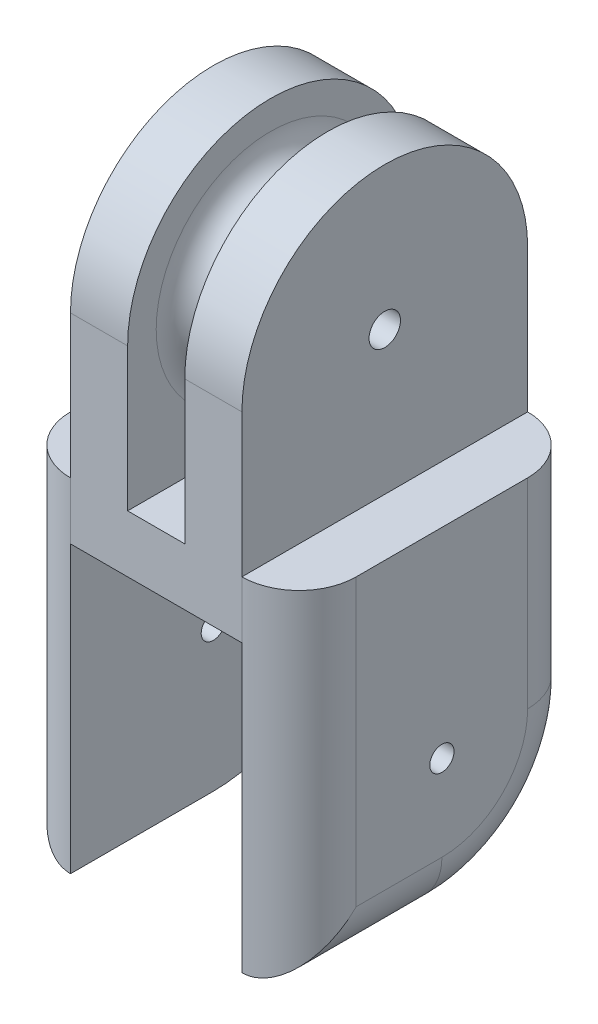
from build123d import *

# Parameters (mm, degrees)
SKETCH1_W           = 20
SKETCH1_H           = 20
BOSS_EXTRUDE1_DEPTH = 4
SKETCH4_W           = 4
SKETCH4_H           = 20
BOSS_EXTRUDE2_DEPTH = 10
BOSS_EXTRUDE3_DEPTH = 4
BOSS_EXTRUDE4_START = -4
BOSS_EXTRUDE4_DEPTH = 4
SKETCH7_R           = 0.85
CUT_EXTRUDE1_DEPTH  = 31
FILLET1_R           = 4
SKETCH8_W           = 4
SKETCH8_H           = 20
BOSS_EXTRUDE5_DEPTH = 10
SKETCH9_R           = 10
BOSS_EXTRUDE6_DEPTH = 4
BOSS_EXTRUDE7_START = -4
SKETCH10_R          = 10
BOSS_EXTRUDE7_DEPTH = 4
SKETCH12_R          = 1.1
CUT_EXTRUDE2_DEPTH  = 31.528675045
SKETCH13_R          = 6
BOSS_EXTRUDE8_DEPTH = 4
SKETCH14_R          = 1.1
CUT_EXTRUDE3_DEPTH  = 4
FILLET2_R           = 2
CUT_EXTRUDE4_REACH  = 29.857
SKETCH16_R          = 0.5


with BuildPart() as part:
    # Sketch1 → Boss-Extrude1 (new body)
    with BuildSketch(Plane(origin=(0, 0, 0), x_dir=(1, 0, 0), z_dir=(0, 1, 0))):
        Rectangle(SKETCH1_W, SKETCH1_H)
    extrude(amount=BOSS_EXTRUDE1_DEPTH)

    # Sketch4 → Boss-Extrude2 (add)
    with BuildSketch(Plane.XZ):
        with Locations((-8, 0)):
            Rectangle(SKETCH4_W, SKETCH4_H)
        with Locations((8, 0)):
            Rectangle(SKETCH4_W, SKETCH4_H)
    extrude(amount=BOSS_EXTRUDE2_DEPTH)

    # Sketch5 → Boss-Extrude3 (add)
    with BuildSketch(Plane.ZY.offset(10)):
        with BuildLine():
            Line((0, -20), (10, -20))
            Line((10, -20), (10, -10))
            ThreePointArc((10, -10), (-7.071067812, -2.928932188), (0, -20))
        make_face()
    extrude(amount=-BOSS_EXTRUDE3_DEPTH)

    # Sketch6 → Boss-Extrude4 (add)
    with BuildSketch(Plane(origin=(10, 0, 0), x_dir=(0, 0, -1), z_dir=(1, 0, 0)).offset(BOSS_EXTRUDE4_START)):
        with BuildLine():
            Line((0, -20), (-10, -20))
            Line((-10, -20), (-10, -10))
            ThreePointArc((-10, -10), (7.071067812, -2.928932188), (0, -20))
        make_face()
    extrude(amount=BOSS_EXTRUDE4_DEPTH)

    # Sketch7 → Cut-Extrude1 (cut, through all)
    with BuildSketch(Plane.ZY.offset(10)):
        with Locations((0, -10)):
            Circle(SKETCH7_R)
    extrude(amount=-CUT_EXTRUDE1_DEPTH, mode=Mode.SUBTRACT)

    # Fillet1
    fillet1_edges = [part.edges().sort_by_distance(p)[0] for p in [
        (-10, -8, 10),
        (-10, -17.071067812, -7.071067812),
        (10, -8, 10),
        (10, -17.071067812, -7.071067812),
        (-10, -3, -10),
        (10, -3, -10),
        (10, -20, 5),
        (-10, -20, 5),
    ]]
    fillet(fillet1_edges, radius=FILLET1_R - 0.0001)  # a hair under: the kernel refuses the full size

    # Sketch8 → Boss-Extrude5 (add)
    with BuildSketch(Plane(origin=(0, 4, 0), x_dir=(1, 0, 0), z_dir=(0, 1, 0))):
        with Locations((4, 0)):
            Rectangle(SKETCH8_W, SKETCH8_H)
        with Locations((-4, 0)):
            Rectangle(SKETCH8_W, SKETCH8_H)
    extrude(amount=BOSS_EXTRUDE5_DEPTH)

    # Sketch9 → Boss-Extrude6 (add)
    with BuildSketch(Plane(origin=(6, 0, 0), x_dir=(0, 0, -1), z_dir=(1, 0, 0))):
        with Locations((0, 14)):
            Circle(SKETCH9_R)
    extrude(amount=-BOSS_EXTRUDE6_DEPTH)

    # Sketch10 → Boss-Extrude7 (add)
    with BuildSketch(Plane.ZY.offset(6).offset(BOSS_EXTRUDE7_START)):
        with Locations((0, 14)):
            Circle(SKETCH10_R)
    extrude(amount=BOSS_EXTRUDE7_DEPTH)

    # Sketch12 → Cut-Extrude2 (cut, through all)
    with BuildSketch(Plane.ZY.offset(6)):
        with Locations((0, 14)):
            Circle(SKETCH12_R)
    extrude(amount=-CUT_EXTRUDE2_DEPTH, mode=Mode.SUBTRACT)

    # Sketch13 → Boss-Extrude8 (add)
    with BuildSketch(Plane(origin=(-2, 0, 0), x_dir=(0, 0, -1), z_dir=(1, 0, 0))):
        with Locations(Location((0, 14, 0), (0, 0, 180))):
            Circle(SKETCH13_R)
    extrude(amount=BOSS_EXTRUDE8_DEPTH)

    # Sketch14 → Cut-Extrude3 (cut)
    with BuildSketch(Plane(origin=(-2, 0, 0), x_dir=(0, 0, -1), z_dir=(1, 0, 0))):
        with Locations(Location((0, 14, 0), (0, 0, 180))):
            Circle(SKETCH14_R)
    extrude(amount=CUT_EXTRUDE3_DEPTH, mode=Mode.SUBTRACT)

    # Fillet2
    fillet2_edges = [part.edges().sort_by_distance(p)[0] for p in [
        (-2, 14, -6),
        (2, 14, -6),
    ]]
    fillet(fillet2_edges, radius=FILLET2_R - 0.0001)  # a hair under: the kernel refuses the full size

    # Sketch16 → Cut-Extrude4 (cut, up to next)
    with BuildSketch(Plane.XZ, mode=Mode.PRIVATE) as cut_extrude4_sk1:
        with Locations(Location((0, -6, 0), (0, 0, 270))):
            Circle(SKETCH16_R)
    cut_extrude4_tool1 = extrude(cut_extrude4_sk1.sketch, amount=-CUT_EXTRUDE4_REACH, mode=Mode.PRIVATE) & part.part
    # Sketch16 → Cut-Extrude4 (cut, up to next)
    with BuildSketch(Plane.XZ, mode=Mode.PRIVATE) as cut_extrude4_sk2:
        with Locations(Location((0, 6, 0), (0, 0, 90))):
            Circle(SKETCH16_R)
    cut_extrude4_tool2 = extrude(cut_extrude4_sk2.sketch, amount=-CUT_EXTRUDE4_REACH, mode=Mode.PRIVATE) & part.part
    add(cut_extrude4_tool1.solids().sort_by_distance((0, 0, -6))[0], mode=Mode.SUBTRACT)
    add(cut_extrude4_tool2.solids().sort_by_distance((0, 0, 6))[0], mode=Mode.SUBTRACT)


solid = part.part
